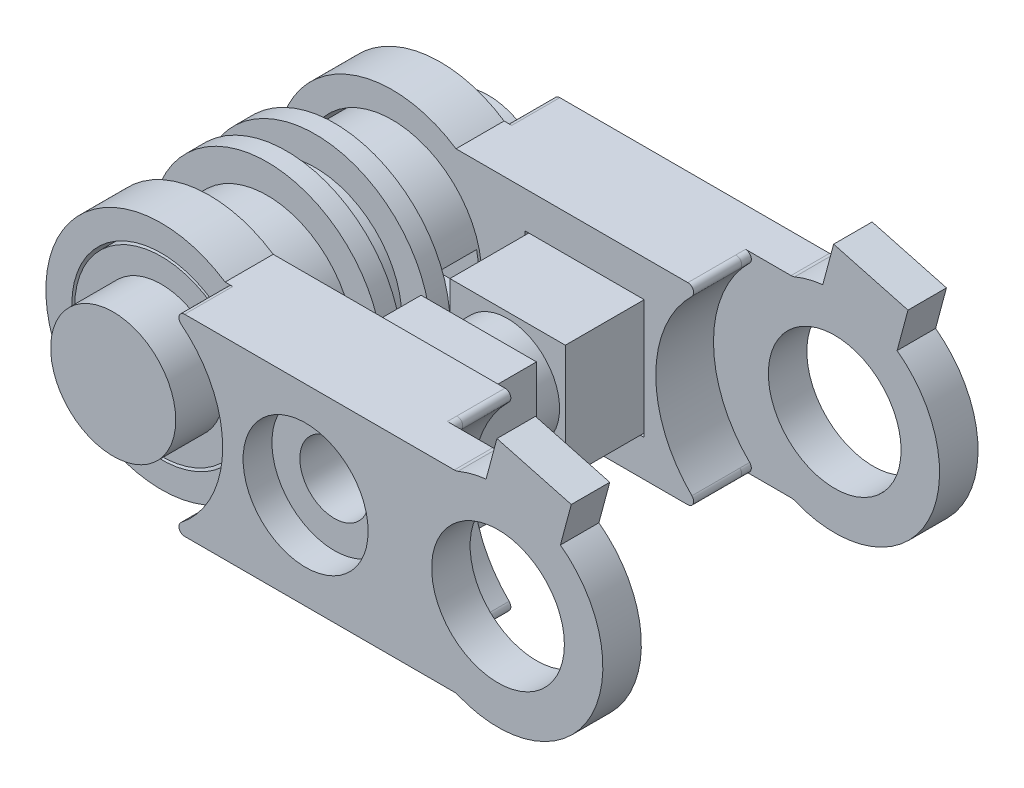
from build123d import *
from build123d.topology import SkipClean

# Parameters (mm, degrees)
SKETCH_1_R                   = 4.5
EXTRUDE_1_DEPTH              = 3
SKETCH_2_R                   = 6
EXTRUDE_2_DEPTH              = 1
EXTRUDE_START                = 1.5
SKETCH_3_R                   = 4.5
EXTRUDE_3_DEPTH              = 1.5
SKETCH_4_R                   = 6
EXTRUDE_4_DEPTH              = 1
EXTRUDE_START_2              = 3
SKETCH_5_R                   = 4.5
EXTRUDE_5_DEPTH              = 3
SKETCH_6_R                   = 6
EXTRUDE_6_DEPTH              = 1
EXTRUDE_START_3              = 1
SKETCH_7_R                   = 6
EXTRUDE_7_DEPTH              = 1
SKETCH_10_R                  = 4.25
EXTRUDE_10_DEPTH             = 1.5
SKETCH_11_R                  = 3.25
EXTRUDE_11_DEPTH             = 2.5
SKETCH_12_R                  = 4.39
EXTRUDE_12_DEPTH             = 1.5
EXTRUDE_13_DEPTH             = 0.5
FILLET_START                 = 3
FILLET_9_DEPTH               = 2.5
SKETCH_14_R                  = 3.45
EXTRUDE_14_DEPTH             = 2
EXTRUDE_15_DEPTH             = 1
SKETCH_16_R                  = 1.8
CUT_EXTRUDE_1_DEPTH          = 33.61828475
SKETCH_17_W                  = 6.2
SKETCH_17_H                  = 6.2
CUT_EXTRUDE_2_DEPTH          = 2
SKETCH_18_W                  = 6
SKETCH_18_H                  = 6
EXTRUDE_16_DEPTH             = 11.5
SKETCH_19_R                  = 1.8
CUT_EXTRUDE_3_DEPTH          = 30.899038446
CUT_EXTRUDE_4_DEPTH          = 0.75
CUT_EXTRUDE_4_DEPTH_BACK     = 0.75
SKETCH_20_W                  = 6
SKETCH_20_H                  = 6
SKETCH_20_R                  = 2.7
SKETCH_21_R                  = 3.25
CUT_EXTRUDE_5_DEPTH          = 1.5
CUT_EXTRUDE_6_DEPTH          = 1
EXTRUDE_17_DEPTH             = 2
EXTRUDE_18_DEPTH             = 2
SKETCH_26_R                  = 6
SKETCH_26_R_2                = 5.8
CUT_EXTRUDE_8_DEPTH          = 31.240898289
SKETCH_27_R                  = 6
SKETCH_27_R_2                = 5.8
CUT_EXTRUDE_9_DEPTH          = 31.240898289
SKETCH_28_R                  = 5.8
SKETCH_28_R_2                = 4.25
CUT_EXTRUDE_10_DEPTH         = 1
CUT_EXTRUDE_START            = 1
SKETCH_29_R                  = 5.8
SKETCH_29_R_2                = 4.25
CUT_EXTRUDE_11_DEPTH         = 1
SKETCH_30_R                  = 4.39
EXTRUDE_19_DEPTH             = 1
SKETCH_31_R                  = 4.39
EXTRUDE_20_DEPTH             = 1
CUT_EXTRUDE_START_2          = -14.5
CUT_EXTRUDE_12_OUTLINE_R     = 4.65
CUT_EXTRUDE_12_OUTLINE_R_2   = 4.39
CUT_EXTRUDE_12_DEPTH         = 2.5
CUT_EXTRUDE_START_3          = -2.5
CUT_EXTRUDE_12_2_OUTLINE_R   = 4.65
CUT_EXTRUDE_12_2_OUTLINE_R_2 = 4.39
CUT_EXTRUDE_12_2_DEPTH       = 2.5
SKETCH_33_R                  = 4.5
SKETCH_33_R_2                = 4.25
EXTRUDE_21_DEPTH             = 2.5
EXTRUDE_START_4              = 2.5
SKETCH_34_R                  = 4.5
SKETCH_34_R_2                = 4.25
EXTRUDE_22_DEPTH             = 2.5
SKETCH_25_W                  = 3
SKETCH_25_H                  = 2
CUT_EXTRUDE_13_DEPTH         = 33.951660494


with BuildPart() as part:
    # ｽｹｯﾁ1 → ﾎﾞｽ - 押し出し1 (new body)
    with BuildSketch(Plane.XY):
        Circle(SKETCH_1_R)
    extrude(amount=EXTRUDE_1_DEPTH)

    # ｽｹｯﾁ2 → ﾎﾞｽ - 押し出し2 (add)
    with BuildSketch(Plane(origin=(0, 0, 0), x_dir=(-1, 0, 0), z_dir=(0, 0, -1))):
        Circle(SKETCH_2_R)
    extrude(amount=EXTRUDE_2_DEPTH)

    # ｽｹｯﾁ3 → ﾎﾞｽ - 押し出し3 (add)
    with BuildSketch(Plane(origin=(0, 0, -1), x_dir=(-1, 0, 0), z_dir=(0, 0, -1)).offset(EXTRUDE_START)):
        with Locations(Location((0, 0, 0), (0, 0, 180))):
            Circle(SKETCH_3_R)
    extrude(amount=-EXTRUDE_3_DEPTH)

    # ｽｹｯﾁ4 → ﾎﾞｽ - 押し出し4 (add)
    with BuildSketch(Plane(origin=(0, 0, -2.5), x_dir=(-1, 0, 0), z_dir=(0, 0, -1))):
        Circle(SKETCH_4_R)
    extrude(amount=EXTRUDE_4_DEPTH)

    # ｽｹｯﾁ5 → ﾎﾞｽ - 押し出し5 (add)
    with BuildSketch(Plane(origin=(0, 0, -3.5), x_dir=(-1, 0, 0), z_dir=(0, 0, -1)).offset(EXTRUDE_START_2)):
        with Locations(Location((0, 0, 0), (0, 0, 180))):
            Circle(SKETCH_5_R)
    extrude(amount=-EXTRUDE_5_DEPTH)

    # ｽｹｯﾁ6 → ﾎﾞｽ - 押し出し6 (add)
    with BuildSketch(Plane(origin=(0, 0, -6.5), x_dir=(-1, 0, 0), z_dir=(0, 0, -1))):
        Circle(SKETCH_6_R)
    extrude(amount=EXTRUDE_6_DEPTH)

    # ｽｹｯﾁ7 → ﾎﾞｽ - 押し出し7 (add)
    with BuildSketch(Plane.XY.offset(3).offset(EXTRUDE_START_3)):
        with Locations(Location((0, 0, 0), (0, 0, 180))):
            Circle(SKETCH_7_R)
    extrude(amount=-EXTRUDE_7_DEPTH)

    # ｽｹｯﾁ10 → ﾎﾞｽ - 押し出し10 (add)
    with BuildSketch(Plane.XY.offset(4)):
        Circle(SKETCH_10_R)
    extrude_10 = extrude(amount=EXTRUDE_10_DEPTH)

    # ｽｹｯﾁ11 → ﾎﾞｽ - 押し出し11 (add)
    with BuildSketch(Plane.XY.offset(5.5)):
        Circle(SKETCH_11_R)
    extrude_11 = extrude(amount=EXTRUDE_11_DEPTH)

    # ﾐﾗｰ1: ﾎﾞｽ - 押し出し10, ﾎﾞｽ - 押し出し11 across plane
    add(extrude_10.mirror(Plane.XY.offset(-1.75)))
    add(extrude_11.mirror(Plane.XY.offset(-1.75)))

    # ｽｹｯﾁ26 → ｶｯﾄ - 押し出し8 (cut, through all)
    with BuildSketch(Plane(origin=(0, 0, 3), x_dir=(-1, 0, 0), z_dir=(0, 0, -1))):
        Circle(SKETCH_26_R)
        Circle(SKETCH_26_R_2, mode=Mode.SUBTRACT)
    extrude(amount=-CUT_EXTRUDE_8_DEPTH, mode=Mode.SUBTRACT)

    # ｽｹｯﾁ27 → ｶｯﾄ - 押し出し9 (cut, through all)
    with BuildSketch(Plane.XY.offset(-6.5)):
        with Locations(Location((0, 0, 0), (0, 0, 180))):
            Circle(SKETCH_27_R)
        with Locations(Location((0, 0, 0), (0, 0, 180))):
            Circle(SKETCH_27_R_2, mode=Mode.SUBTRACT)
    extrude(amount=-CUT_EXTRUDE_9_DEPTH, mode=Mode.SUBTRACT)

    # ｽｹｯﾁ28 → ｶｯﾄ - 押し出し10 (cut)
    with BuildSketch(Plane(origin=(0, 0, 4), x_dir=(-1, 0, 0), z_dir=(0, 0, -1))):
        with Locations(Location((0, 0, 0), (0, 0, 180))):
            Circle(SKETCH_28_R)
        with Locations(Location((0, 0, 0), (0, 0, 180))):
            Circle(SKETCH_28_R_2, mode=Mode.SUBTRACT)
    extrude(amount=CUT_EXTRUDE_10_DEPTH, mode=Mode.SUBTRACT)

    # ｽｹｯﾁ29 → ｶｯﾄ - 押し出し11 (cut)
    with BuildSketch(Plane.XY.offset(-7.5).offset(CUT_EXTRUDE_START)):
        Circle(SKETCH_29_R)
        with Locations(Location((0, 0, 0), (0, 0, 180))):
            Circle(SKETCH_29_R_2, mode=Mode.SUBTRACT)
    extrude(amount=-CUT_EXTRUDE_11_DEPTH, mode=Mode.SUBTRACT)

    # ｽｹｯﾁ33 → ﾎﾞｽ - 押し出し21 (add)
    with BuildSketch(Plane.XY.offset(3)):
        Circle(SKETCH_33_R)
        Circle(SKETCH_33_R_2, mode=Mode.SUBTRACT)
    extrude(amount=EXTRUDE_21_DEPTH)

    # ｽｹｯﾁ34 → ﾎﾞｽ - 押し出し22 (add)
    with BuildSketch(Plane(origin=(0, 0, -6.5), x_dir=(-1, 0, 0), z_dir=(0, 0, -1)).offset(EXTRUDE_START_4)):
        with Locations(Location((0, 0, 0), (0, 0, 180))):
            Circle(SKETCH_34_R)
        Circle(SKETCH_34_R_2, mode=Mode.SUBTRACT)
    extrude(amount=-EXTRUDE_22_DEPTH)

    # ｽｹｯﾁ25 → ｶｯﾄ - 押し出し13 (cut, through all)
    with BuildSketch(Plane.ZY.offset(4.5)):
        with Locations((-5, 0)):
            Rectangle(SKETCH_25_W, SKETCH_25_H)
        with Locations((1.5, 0)):
            Rectangle(SKETCH_25_W, SKETCH_25_H)
    extrude(amount=-CUT_EXTRUDE_13_DEPTH, mode=Mode.SUBTRACT)


with BuildPart() as body_2:
    # ｽｹｯﾁ12 → ﾎﾞｽ - 押し出し12 (new body)
    with BuildSketch(Plane.XY.offset(4)):
        with BuildLine():
            Line((3.31662479, 5), (16.167246421, 5))
            ThreePointArc((16.167246421, 5), (13.7, 0), (16.167246421, -5))
            Line((16.167246421, -5), (3.31662479, -5))
            ThreePointArc((3.31662479, -5), (-6, 0), (3.31662479, 5))
        make_face()
        Circle(SKETCH_12_R, mode=Mode.SUBTRACT)
    extrude(amount=EXTRUDE_12_DEPTH)

    # ｽｹｯﾁ13 → ﾎﾞｽ - 押し出し13 (add)
    with BuildSketch(Plane.XY.offset(5.5)):
        with BuildLine():
            Line((15.366426865, 5), (3.71350239, 5))
            ThreePointArc((3.71350239, 5), (3.430114232, 4.798443648), (3.527517295, 4.464607679))
            ThreePointArc((3.527517295, 4.464607679), (5.69, 0), (3.527517295, -4.464607679))
            ThreePointArc((3.527517295, -4.464607679), (3.430114232, -4.798443648), (3.71350239, -5))
            Line((3.71350239, -5), (15.366426865, -5))
            ThreePointArc((15.366426865, -5), (15.643997495, -4.813818037), (15.577043825, -4.486363636))
            ThreePointArc((15.577043825, -4.486363636), (13.7, 0), (15.577043825, 4.486363636))
            ThreePointArc((15.577043825, 4.486363636), (15.643997495, 4.813818037), (15.366426865, 5))
        make_face()
    extrude(amount=EXTRUDE_13_DEPTH)

    # ﾌｨﾚｯﾄ9: read off the stored shape, not the designer's step
    # ﾌｨﾚｯﾄ9 outline → ﾌｨﾚｯﾄ9 (cut)
    with BuildSketch(Plane.XY.offset(FILLET_START)):
        with BuildLine():
            ThreePointArc((16.167246421, -5), (15.864163753, -4.752352947), (15.577043825, -4.486363636))
            ThreePointArc((15.577043825, -4.486363636), (15.643997495, -4.813818036), (15.366426865, -5))
            Line((15.366426865, -5), (16.167246421, -5))
        make_face()
        with BuildLine():
            ThreePointArc((15.366426865, 5), (15.643997495, 4.813818036), (15.577043825, 4.486363636))
            ThreePointArc((15.577043825, 4.486363636), (15.864163753, 4.752352947), (16.167246421, 5))
            Line((16.167246421, 5), (15.366426865, 5))
        make_face()
    extrude(amount=FILLET_9_DEPTH, mode=Mode.SUBTRACT)

    # ｽｹｯﾁ14 → ﾎﾞｽ - 押し出し14 (add)
    with BuildSketch(Plane.XY.offset(6)):
        with BuildLine():
            Line((3.71350239, 5), (17.730088107, 5))
            ThreePointArc((17.730088107, 5), (17.827318666, 5.009544886), (17.920837006, 5.037815126))
            ThreePointArc((17.920837006, 5.037815126), (25.45, 0), (17.920837006, -5.037815126))
            ThreePointArc((17.920837006, -5.037815126), (17.827318666, -5.009544886), (17.730088107, -5))
            Line((17.730088107, -5), (3.71350239, -5))
            ThreePointArc((3.71350239, -5), (3.430114232, -4.798443648), (3.527517295, -4.464607679))
            ThreePointArc((3.527517295, -4.464607679), (5.69, 0), (3.527517295, 4.464607679))
            ThreePointArc((3.527517295, 4.464607679), (3.430114232, 4.798443648), (3.71350239, 5))
        make_face()
        with Locations((20, 0)):
            Circle(SKETCH_14_R, mode=Mode.SUBTRACT)
    extrude(amount=EXTRUDE_14_DEPTH)

    # ｽｹｯﾁ15 → ﾎﾞｽ - 押し出し15 (add)
    with BuildSketch(Plane(origin=(0, 0, 4), x_dir=(-1, 0, 0), z_dir=(0, 0, -1))):
        with BuildLine():
            Line((-15.366426865, 5), (-4.195235393, 5))
            ThreePointArc((-4.195235393, 5), (-3.914929437, 4.806904497), (-3.995462279, 4.476190476))
            ThreePointArc((-3.995462279, 4.476190476), (-6, 0), (-3.995462279, -4.476190476))
            ThreePointArc((-3.995462279, -4.476190476), (-3.914929437, -4.806904497), (-4.195235393, -5))
            Line((-4.195235393, -5), (-15.366426865, -5))
            ThreePointArc((-15.366426865, -5), (-15.643997495, -4.813818037), (-15.577043825, -4.486363636))
            ThreePointArc((-15.577043825, -4.486363636), (-13.7, 0), (-15.577043825, 4.486363636))
            ThreePointArc((-15.577043825, 4.486363636), (-15.643997495, 4.813818037), (-15.366426865, 5))
        make_face()
    extrude(amount=EXTRUDE_15_DEPTH)


with BuildPart() as body_3:
    # ﾐﾗｰ2: mirrored copy
    add(body_2.part.mirror(Plane.XY.offset(-1.75)))


with BuildPart() as cut_extrude_1_tool:
    # ｽｹｯﾁ16 → ｶｯﾄ - 押し出し1 (new, through all)
    with BuildSketch(Plane.XY.offset(8)):
        with Locations((10, 0)):
            Circle(SKETCH_16_R)
    extrude(amount=-CUT_EXTRUDE_1_DEPTH)


with BuildPart() as body_2_1:
    add(body_2.part)

    # ｶｯﾄ - 押し出し1: cut by cut_extrude_1_tool
    add(cut_extrude_1_tool.part, mode=Mode.SUBTRACT)

    # ｽｹｯﾁ18 → ﾎﾞｽ - 押し出し16 (add)
    with BuildSketch(Plane(origin=(0, 0, 3), x_dir=(-1, 0, 0), z_dir=(0, 0, -1))):
        with Locations((-10, 0)):
            Rectangle(SKETCH_18_W, SKETCH_18_H)
    extrude(amount=EXTRUDE_16_DEPTH)

    # ｽｹｯﾁ19 → ｶｯﾄ - 押し出し3 (cut, through all)
    with BuildSketch(Plane.XY.offset(3)):
        with Locations((10, 0)):
            Circle(SKETCH_19_R)
    extrude(amount=-CUT_EXTRUDE_3_DEPTH, mode=Mode.SUBTRACT)

    # ｽｹｯﾁ20 → ｶｯﾄ - 押し出し4 (cut, two sides: drawn at the far end of the back side and taken through both)
    with BuildSketch(Plane.XY.offset(-1.75).offset(-CUT_EXTRUDE_4_DEPTH_BACK)):
        with Locations((10, 0)):
            Rectangle(SKETCH_20_W, SKETCH_20_H)
        with Locations((10, 0)):
            Circle(SKETCH_20_R, mode=Mode.SUBTRACT)
    extrude(amount=CUT_EXTRUDE_4_DEPTH + CUT_EXTRUDE_4_DEPTH_BACK, mode=Mode.SUBTRACT)

    # ｽｹｯﾁ21 → ｶｯﾄ - 押し出し5 (cut)
    with BuildSketch(Plane.XY.offset(8)):
        with Locations((10, 0)):
            Circle(SKETCH_21_R)
    extrude(amount=-CUT_EXTRUDE_5_DEPTH, mode=Mode.SUBTRACT)

    # ｽｹｯﾁ23 → ﾎﾞｽ - 押し出し17 (add)
    with BuildSketch(Plane.XY.offset(8)):
        Polygon((19.012837862, 4.043267356), (22.876541167, 3.007991176), (23.80828973, 6.48532415), (19.944586424, 7.520600331), align=None)
    extrude(amount=-EXTRUDE_17_DEPTH)

    # ｽｹｯﾁ30 → ﾎﾞｽ - 押し出し19 (add)
    with BuildSketch(Plane(origin=(0, 0, 4), x_dir=(-1, 0, 0), z_dir=(0, 0, -1))):
        with BuildLine():
            Line((-4.195235393, -5), (-3.31662479, -5))
            ThreePointArc((-3.31662479, -5), (6, 0), (-3.31662479, 5))
            Line((-3.31662479, 5), (-4.195235393, 5))
            ThreePointArc((-4.195235393, 5), (-3.914929437, 4.806904497), (-3.995462279, 4.476190476))
            ThreePointArc((-3.995462279, 4.476190476), (-6, 0), (-3.995462279, -4.476190476))
            ThreePointArc((-3.995462279, -4.476190476), (-3.914929437, -4.806904497), (-4.195235393, -5))
        make_face()
        with Locations(Location((0, 0, 0), (0, 0, 180))):
            Circle(SKETCH_30_R, mode=Mode.SUBTRACT)
    extrude(amount=EXTRUDE_19_DEPTH)

    # Cut-Extrude 12 2 outline → Cut-Extrude 12 2 (cut)
    with BuildSketch(Plane.XY.offset(5.5).offset(CUT_EXTRUDE_START_3)):
        Circle(CUT_EXTRUDE_12_2_OUTLINE_R)
        Circle(CUT_EXTRUDE_12_2_OUTLINE_R_2, mode=Mode.SUBTRACT)
    extrude(amount=CUT_EXTRUDE_12_2_DEPTH, mode=Mode.SUBTRACT)


with BuildPart() as body_3_1:
    add(body_3.part)

    # ｶｯﾄ - 押し出し1: cut by cut_extrude_1_tool
    add(cut_extrude_1_tool.part, mode=Mode.SUBTRACT)

    # ｽｹｯﾁ17 → ｶｯﾄ - 押し出し2 (cut)
    with BuildSketch(Plane.XY.offset(-6.5)):
        with Locations((10, 0)):
            Rectangle(SKETCH_17_W, SKETCH_17_H)
    extrude(amount=-CUT_EXTRUDE_2_DEPTH, mode=Mode.SUBTRACT)

    # ｽｹｯﾁ22 → ｶｯﾄ - 押し出し6 (cut)
    with BuildSketch(Plane(origin=(0, 0, -11.5), x_dir=(-1, 0, 0), z_dir=(0, 0, -1))):
        Polygon((-11.674315781, 2.9), (-13.348631561, 0), (-11.674315781, -2.9), (-8.325684219, -2.9), (-6.651368439, 0), (-8.325684219, 2.9), align=None)
    extrude(amount=-CUT_EXTRUDE_6_DEPTH, mode=Mode.SUBTRACT)

    # ｽｹｯﾁ24 → ﾎﾞｽ - 押し出し18 (add)
    with BuildSketch(Plane(origin=(0, 0, -11.5), x_dir=(-1, 0, 0), z_dir=(0, 0, -1))):
        Polygon((-22.876541167, 3.007991176), (-19.012837862, 4.043267356), (-19.944586424, 7.520600331), (-23.80828973, 6.48532415), align=None)
    extrude(amount=-EXTRUDE_18_DEPTH)

    # ｽｹｯﾁ31 → ﾎﾞｽ - 押し出し20 (add)
    with SkipClean():  # the faces are left unmerged after this step: merging them gives an invalid solid
        with BuildSketch(Plane.XY.offset(-7.5).offset(EXTRUDE_START_3)):
            with BuildLine():
                Line((3.31662479, -5), (4.195235393, -5))
                ThreePointArc((4.195235393, -5), (3.914929437, -4.806904497), (3.995462279, -4.476190476))
                ThreePointArc((3.995462279, -4.476190476), (6, 0), (3.995462279, 4.476190476))
                ThreePointArc((3.995462279, 4.476190476), (3.914929437, 4.806904497), (4.195235393, 5))
                Line((4.195235393, 5), (3.31662479, 5))
                ThreePointArc((3.31662479, 5), (-6, 0), (3.31662479, -5))
            make_face()
            Circle(SKETCH_31_R, mode=Mode.SUBTRACT)
        extrude(amount=-EXTRUDE_20_DEPTH)

    # ｶｯﾄ - 押し出し12: read off the stored shape, not the designer's step
    # ｶｯﾄ - 押し出し12 outline → ｶｯﾄ - 押し出し12 (cut)
    with SkipClean():  # the faces are left unmerged after this step: merging them gives an invalid solid
        with BuildSketch(Plane.XY.offset(5.5).offset(CUT_EXTRUDE_START_2)):
            Circle(CUT_EXTRUDE_12_OUTLINE_R)
            Circle(CUT_EXTRUDE_12_OUTLINE_R_2, mode=Mode.SUBTRACT)
        extrude(amount=CUT_EXTRUDE_12_DEPTH, mode=Mode.SUBTRACT)


solid = Compound([part.part, body_2_1.part, body_3_1.part])
